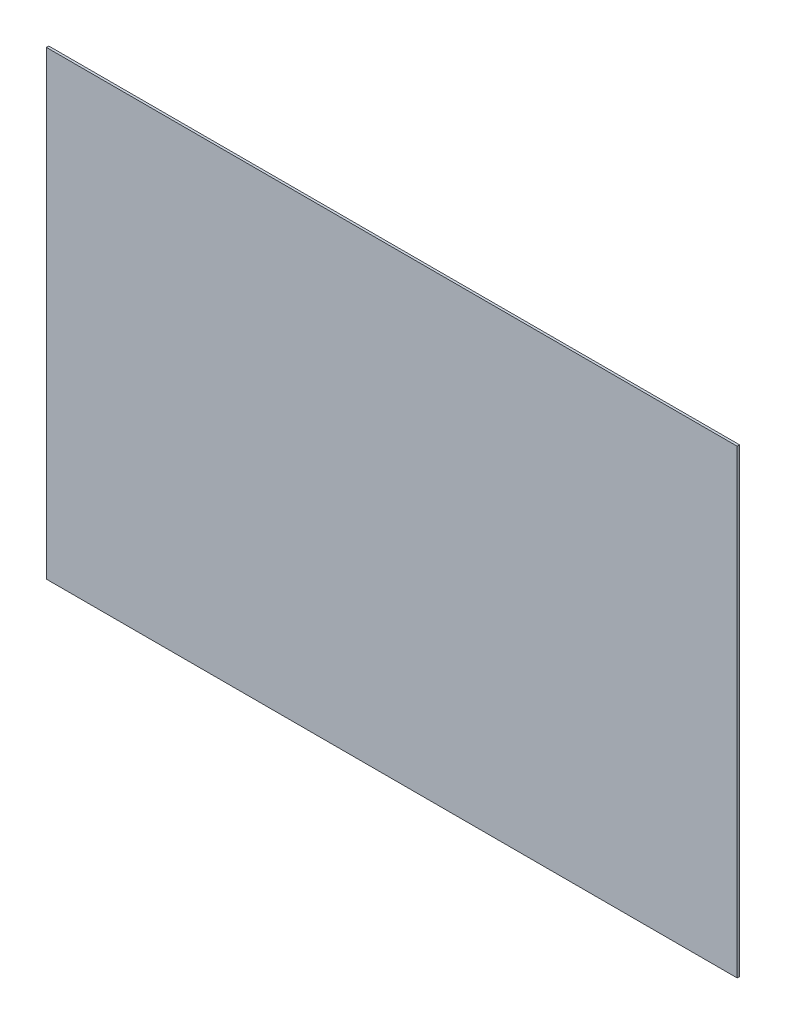
from build123d import *

# Parameters (mm, degrees)
SKETCH1_W           = 914.4
SKETCH1_H           = 609.6
BOSS_EXTRUDE1_DEPTH = 3.175


with BuildPart() as part:
    # Sketch1 → Boss-Extrude1 (new body)
    with BuildSketch(Plane.XY):
        with Locations((0, 304.8)):
            Rectangle(SKETCH1_W, SKETCH1_H)
    extrude(amount=-BOSS_EXTRUDE1_DEPTH)


solid = part.part
